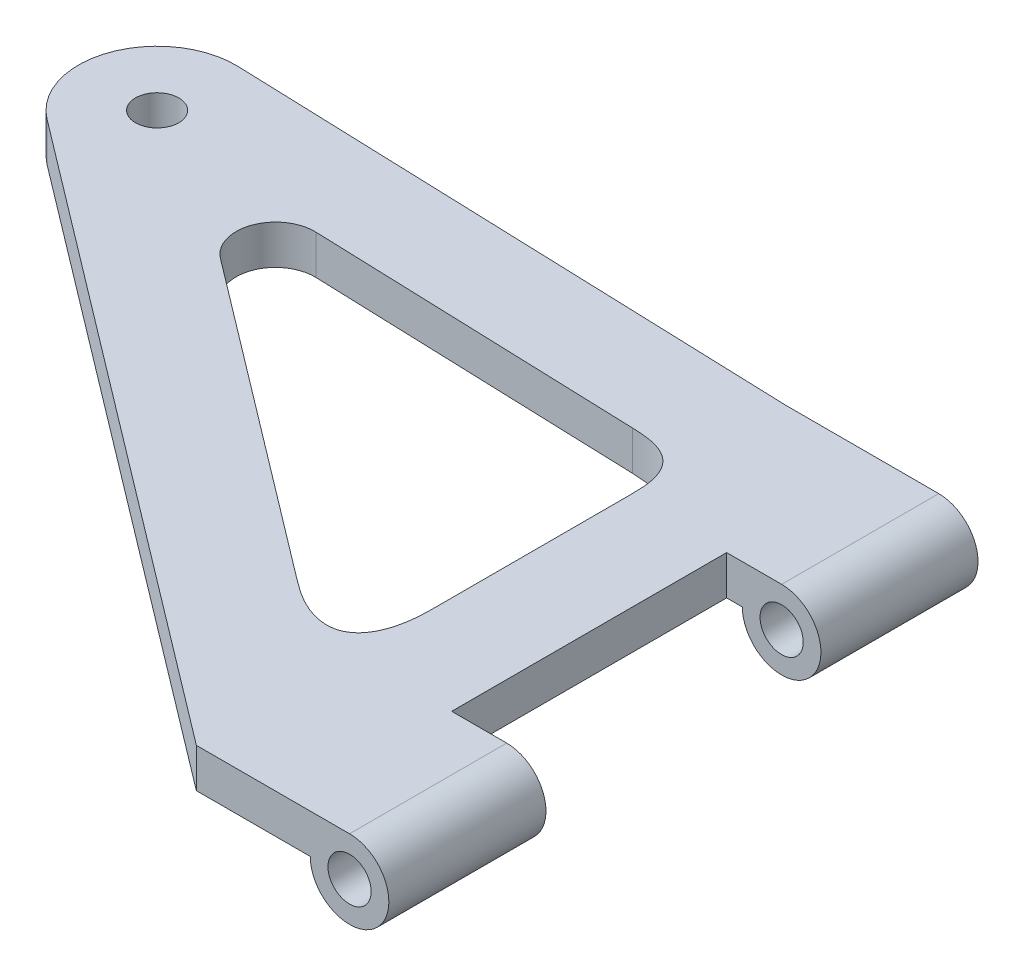
from build123d import *

# Parameters (mm, degrees)
SKETCH_1_R              = 1.1
EXTRUDE_1_DEPTH         = 2
EXTRUDE_2_DEPTH         = 8
EXTRUDE_START           = -22
EXTRUDE_3_DEPTH         = 8
HOLE_WIZARD_2_2_2_2_1_D = 2.2


with BuildPart() as part:
    # 草图1 → 凸台-拉伸1 (new body)
    with BuildSketch(Plane(origin=(0, 0, 0), x_dir=(1, 0, 0), z_dir=(0, 1, 0))):
        with BuildLine():
            Line((0, 30), (0, 0))
            Line((0, 0), (5, 0))
            Line((5, 0), (36.416208358, 23.812220652))
            ThreePointArc((36.416208358, 23.812220652), (37.768928241, 28.339843241), (33.861821998, 30.997612643))
            Line((33.861821998, 30.997612643), (5, 30))
            Line((5, 30), (0, 30))
        make_face()
        with BuildLine():
            Line((5, 6.273959963), (5, 24.997014021))
            Line((5, 24.997014021), (24.577554456, 25.673714745))
            ThreePointArc((24.577554456, 25.673714745), (26.531107578, 24.344830044), (25.854747636, 22.08101875))
            Line((25.854747636, 22.08101875), (5, 6.273959963))
        make_face(mode=Mode.SUBTRACT)
        with Locations(Location((34, 27, 0), (0, 0, 270))):
            Circle(SKETCH_1_R, mode=Mode.SUBTRACT)
    extrude(amount=EXTRUDE_1_DEPTH)

    # 圆角1
    # a fillet whose section is not a circle: 3 mm, written as the material it adds along each edge (its section moved 0.00015 mm through the faces so that the kernel can cut it)
    with BuildSketch(Plane(origin=(5, 0, -6.273959963), x_dir=(-2.4841613370279438e-05, 0, -0.999999999691447), z_dir=(0, 1, 0))) as fillet_1_piece_1:
        with BuildLine():
            add(Edge.make_bspline([(6.038255155, 0), (5.16698511, 2.1644e-05), (4.295715065, 4.3288e-05), (2.48642459, -0.523937582), (1.919396592, -1.665153012), (2.594631071, -3.423603004), (3.120906314, -4.117970242), (3.647181556, -4.81233748)], knots=[0, 0, 0, 0, 0, 0, 0.5, 0.5, 1, 1, 1, 1, 1, 1], degree=5))
            Line((3.647181556, -4.81233748), (3.599363965, -4.848579417))
            ThreePointArc((3.599363965, -4.848579417), (1.775832959, -2.442365375), (-0.047817591, -0.036241938))
            Line((-0.047817591, -0.036241938), (1.49e-06, 0.06))
            ThreePointArc((1.49e-06, 0.06), (3.019129066, 0.059925), (6.038256646, 0.06))
            Line((6.038256646, 0.06), (6.038255155, 0))
        make_face()
    extrude(amount=2)
    with BuildSketch(Plane(origin=(5, 0, -24.997014021), x_dir=(-5.1758116243326517e-05, 0, 0.9999999986605487), z_dir=(0, 1, 0))) as fillet_1_piece_2:
        with BuildLine():
            add(Edge.make_bspline([(2.8980962, 0), (2.407927047, -2.537e-05), (1.917757895, -5.074e-05), (0.835707431, 0.203366759), (0.1742891, 0.842251897), (-0.066497099, 1.916604675), (-0.083455103, 2.406480399), (-0.100413106, 2.896356123)], knots=[0, 0, 0, 0, 0, 0, 0.5, 0.5, 1, 1, 1, 1, 1, 1], degree=5))
            Line((-0.100413106, 2.896356123), (-0.160377189, 2.894280349))
            ThreePointArc((-0.160377189, 2.894280349), (-0.11009568, 1.446104883), (-0.059964082, -0.002075774))
            Line((-0.059964082, -0.002075774), (3.105e-06, -0.06))
            ThreePointArc((3.105e-06, -0.06), (1.449051202, -0.059925), (2.898099305, -0.06))
            Line((2.898099305, -0.06), (2.8980962, 0))
        make_face()
    extrude(amount=2)

    # 草图2 → 凸台-拉伸2 (add)
    with BuildSketch(Plane(origin=(0, 0, -30), x_dir=(-1, 0, 0), z_dir=(0, 0, -1))):
        with BuildLine():
            Line((0, 2), (2.8, 2))
            ThreePointArc((2.8, 2), (4.214213562, -1.414213562), (0.8, 0))
            Line((0.8, 0), (0, 0))
            Line((0, 0), (0, 2))
        make_face()
    extrude(amount=-EXTRUDE_2_DEPTH)

    # 草图2<2> → 凸台-拉伸3 (add)
    with BuildSketch(Plane(origin=(0, 0, -30), x_dir=(-1, 0, 0), z_dir=(0, 0, -1)).offset(EXTRUDE_START)):
        with BuildLine():
            Line((0, 2), (2.8, 2))
            ThreePointArc((2.8, 2), (4.214213562, -1.414213562), (0.8, 0))
            Line((0.8, 0), (0, 0))
            Line((0, 0), (0, 2))
        make_face()
    extrude(amount=-EXTRUDE_3_DEPTH)

    # Ø2.2 (2.2) 直径孔1 (through all)
    with Locations(Plane(origin=(0, 0, -30), x_dir=(-1, 0, 0), z_dir=(0, 0, -1))):
        with Locations((2.8, 0)):
            Hole(HOLE_WIZARD_2_2_2_2_1_D / 2)


with BuildPart() as body_2:
    # 镜向1: mirrored copy
    add(part.part.mirror(Plane(origin=(0, 0, 0), x_dir=(0, 0, 1), z_dir=(1, 0, 0))))


solid = body_2.part
